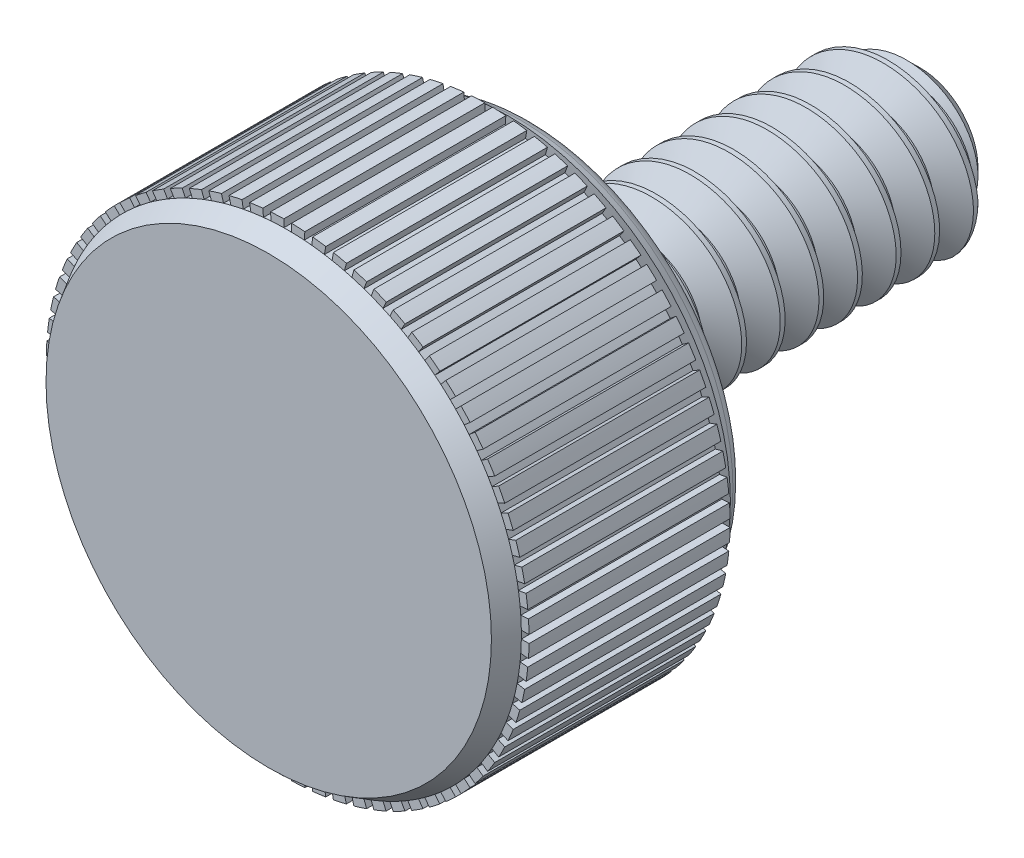
from build123d import *

# Parameters (mm, degrees)
SKETCH1_R               = 1.4224
EXTRUDE1_DEPTH          = 6.35
CHAMFER2_SIZE           = 0.47625
CUT_SWEEP1_PITCH        = 0.635
SKETCH27_R              = 3.571875
BOSS_EXTRUDE4_DEPTH     = 0.4365625
DRAFT1_ANGLE            = -20
FILLET1_R               = 0.34925
SKETCH21_R              = 3.96875
BOSS_EXTRUDE1_DEPTH     = 3.929062
CUT_EXTRUDE1_REACH      = 12.912
CUT_EXTRUDE1_END_RADIUS = 3.96875
SKETCH22_W              = 0.127
SKETCH22_H              = 4.365625
CIRPATTERN1_COUNT       = 72


with BuildPart() as part:
    # Sketch1 → Extrude1 (new body)
    with BuildSketch(Plane.XY):
        Circle(SKETCH1_R)
    extrude(amount=-EXTRUDE1_DEPTH)

    # Chamfer2
    chamfer2_edges = [part.edges().sort_by_distance(p)[0] for p in [
        (-1.4224, 0, -6.35),
    ]]
    chamfer(chamfer2_edges, length=CHAMFER2_SIZE)

    # Cut-Sweep1: the profile of Sketch14 profile screwed along a right-hand helix of 11 turns, 6 arcs to a turn; built about Z, then put on its axis
    cut_sweep1_z = Axis((0, 0, 0), (0, 0, 1))
    cut_sweep1_corners = [(1.4227, 0, 0.000173205), (1.4227, 0, -0.555798205), (1.009955401, 0, -0.3175), (1.009955401, 0, -0.238125)]
    with BuildLine(mode=Mode.PRIVATE) as cut_sweep1_profile:
        Line(cut_sweep1_corners[0], cut_sweep1_corners[1])
        Line(cut_sweep1_corners[1], cut_sweep1_corners[2])
        Line(cut_sweep1_corners[2], cut_sweep1_corners[3])
        Line(cut_sweep1_corners[3], cut_sweep1_corners[0])
    cut_sweep1_cap = Face(cut_sweep1_profile.wire())
    cut_sweep1_turn_angles = [0, 30, 60, 90, 120, 150, 180, 210, 240, 270, 300, 330, 360]
    cut_sweep1_turn_weights = [1, 0.8660254037844387, 1, 0.8660254037844387, 1, 0.8660254037844387, 1, 0.8660254037844387, 1, 0.8660254037844387, 1, 0.8660254037844387, 1]
    cut_sweep1_turn_rails = [Edge.make_bspline([Vector(p[0], p[1], 0).rotate(cut_sweep1_z, cut_sweep1_turn_angles[k]) / cut_sweep1_turn_weights[k] + Vector(0, 0, p[2] + CUT_SWEEP1_PITCH * cut_sweep1_turn_angles[k] / 360) for k in range(13)], [0, 0, 0, 1, 1, 2, 2, 3, 3, 4, 4, 5, 5, 6, 6, 6], 2, cut_sweep1_turn_weights) for p in cut_sweep1_corners]
    cut_sweep1_turn_sides = [Face.make_surface_from_curves(cut_sweep1_turn_rails[p[0]], cut_sweep1_turn_rails[p[1]]) for p in [(0, 1), (1, 2), (2, 3), (3, 0)]]
    cut_sweep1 = Plane(origin=(0, 0, -6.35), x_dir=(0, 1, 0), z_dir=(0, 0, 1)) * Solid(Shell([*[p.moved(Location((0, 0, CUT_SWEEP1_PITCH * i))) for i in range(11) for p in cut_sweep1_turn_sides], cut_sweep1_cap, cut_sweep1_cap.rotate(cut_sweep1_z, 3960).moved(Location((0, 0, CUT_SWEEP1_PITCH * 3960 / 360)))]))
    add(cut_sweep1, mode=Mode.SUBTRACT)

    # Sketch27 → Boss-Extrude4 (add)
    with BuildSketch(Plane.XY):
        Circle(SKETCH27_R)
    extrude(amount=BOSS_EXTRUDE4_DEPTH)

    # Boss-Extrude5 cone 1 section (through the dimple's axis) → Boss-Extrude5 (revolve)
    with BuildSketch(Plane(origin=(0, 0, 0), x_dir=(0, -1, 0), z_dir=(1, 0, 0))):
        Polygon((0, 0), (1.4224, 0), (0, 3.908011881), align=None)
    revolve(axis=Axis((0, 0, 0), (0, 0, -1)))

    # Draft1
    draft1_faces = [part.faces().sort_by_distance(p)[0] for p in [
        (-3.571875, 0, 0.21828125),
    ]]
    draft(draft1_faces, Plane.XY.offset(0.4365625), DRAFT1_ANGLE)

    # Fillet1
    fillet1_edges = [part.edges().sort_by_distance(p)[0] for p in [
        (-3.412979245, 0, 0),
    ]]
    fillet(fillet1_edges, radius=FILLET1_R)

    # Sketch21 → Boss-Extrude1 (add)
    with BuildSketch(Plane.XY.offset(0.4365625)):
        Circle(SKETCH21_R)
    extrude(amount=BOSS_EXTRUDE1_DEPTH)

    # Cut-Extrude1: up to this cylinder (the profile starts outside it)
    cut_extrude1_end = Plane(origin=(0, -0.127, 2.182812), z_dir=(0, 0, -1)) * Cylinder(CUT_EXTRUDE1_END_RADIUS, 34.7615, mode=Mode.PRIVATE)
    # Sketch22 → Cut-Extrude1 (cut, up to the surface)
    with BuildSketch(Plane(origin=(0, 3.96875, 0), x_dir=(-1, 0, 0), z_dir=(0, 1, 0)), mode=Mode.PRIVATE) as cut_extrude1_sk1:
        with Locations((0, 2.1828125)):
            Rectangle(SKETCH22_W, SKETCH22_H)
    cut_extrude1_tool1 = extrude(cut_extrude1_sk1.sketch, amount=-CUT_EXTRUDE1_REACH, mode=Mode.PRIVATE) - cut_extrude1_end
    cut_extrude1 = cut_extrude1_tool1.solids().sort_by_distance((0, 3.96875, 2.182812))[0]
    add(cut_extrude1, mode=Mode.SUBTRACT)

    # CirPattern1: Cut-Extrude1 ×72 about axis
    cirpattern1_axis = Axis((0, 0, 0), (0, 0, 1))
    for i in range(1, CIRPATTERN1_COUNT):
        add(cut_extrude1.rotate(cirpattern1_axis, i * 360 / CIRPATTERN1_COUNT), mode=Mode.SUBTRACT)

    # Sketch29 → Cut-Revolve1 (revolve, cut)
    with BuildSketch(Plane(origin=(0, 0, 0), x_dir=(0, 0, -1), z_dir=(1, 0, 0)), mode=Mode.PRIVATE) as cut_revolve1_sk:
        Polygon((-4.053794643, 3.84175), (-4.365625, 3.661714659), (-4.365625, 4.09575), (-4.053794643, 4.09575), align=None)
        Polygon((-0.4365625, 4.09575), (-0.748392857, 4.09575), (-0.748392857, 3.84175), (-0.4365625, 3.661714659), align=None)
    revolve(cut_revolve1_sk.sketch.rotate(Axis((0, 0, 0), (0, 0, 1)), 90), axis=Axis((0, 0, 0), (0, 0, 1)), mode=Mode.SUBTRACT)


solid = part.part
